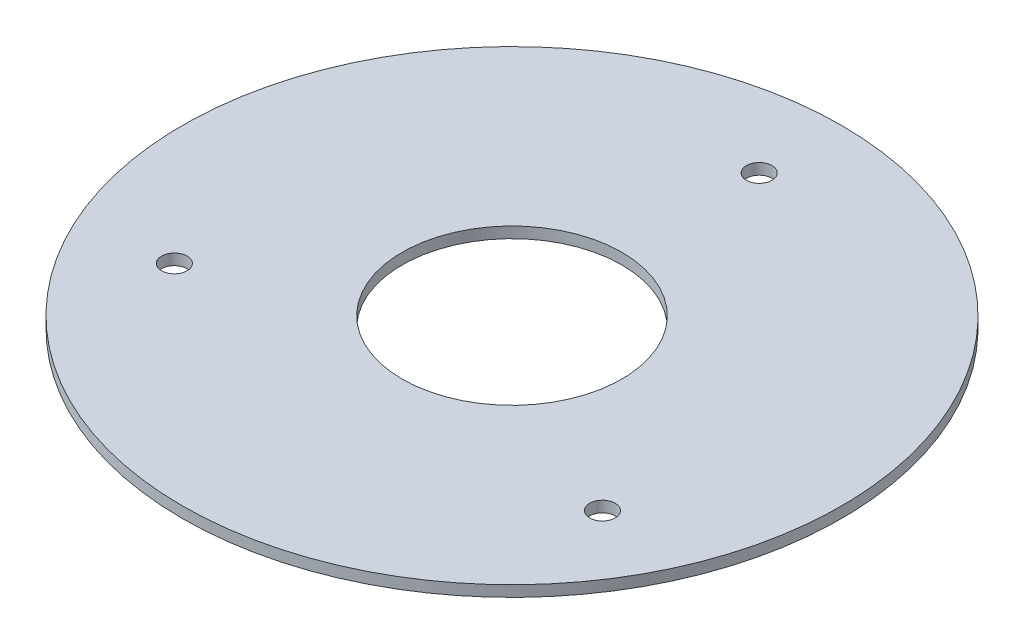
from build123d import *

# Parameters (mm, degrees)
SKETCH1_R           = 60
SKETCH1_R_2         = 20
SKETCH1_R_3         = 2.32306613
BOSS_EXTRUDE1_DEPTH = 2


with BuildPart() as part:
    # Sketch1 → Boss-Extrude1 (new body)
    with BuildSketch(Plane(origin=(0, 0, 0), x_dir=(1, 0, 0), z_dir=(0, 1, 0))):
        Circle(SKETCH1_R)
        Circle(SKETCH1_R_2, mode=Mode.SUBTRACT)
        with Locations((0, 45.00344982)):
            Circle(SKETCH1_R_3, mode=Mode.SUBTRACT)
        with Locations((38.974130802, -22.50172491)):
            Circle(SKETCH1_R_3, mode=Mode.SUBTRACT)
        with Locations((-38.974130802, -22.50172491)):
            Circle(SKETCH1_R_3, mode=Mode.SUBTRACT)
    extrude(amount=BOSS_EXTRUDE1_DEPTH)


solid = part.part
